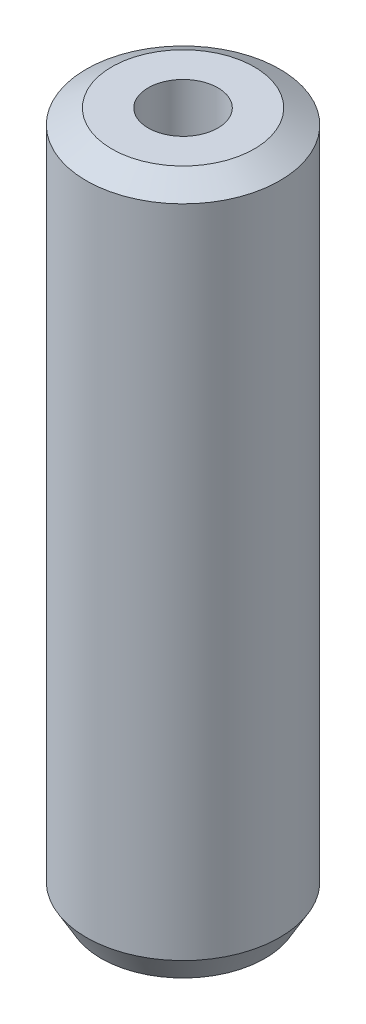
from build123d import *
from OCP.BRepFilletAPI import BRepFilletAPI_MakeChamfer

# Parameters (mm, degrees)
SKETCH1_R           = 35
BOSS_EXTRUDE1_DEPTH = 251.696371733
SKETCH2_R           = 12.617273139
CUT_EXTRUDE1_DEPTH  = 257.517179822
CHAMFER1_SIZE       = 5.330984594
CHAMFER1_SIZE2      = 9.233536171


with BuildPart() as part:
    # Sketch1 → Boss-Extrude1 (new body)
    with BuildSketch(Plane(origin=(0, 0, 0), x_dir=(1, 0, 0), z_dir=(0, 1, 0))):
        Circle(SKETCH1_R)
    extrude(amount=BOSS_EXTRUDE1_DEPTH)

    # Sketch2 → Cut-Extrude1 (cut, through all)
    with BuildSketch(Plane(origin=(0, 0, 0), x_dir=(1, 0, 0), z_dir=(0, 1, 0))):
        Circle(SKETCH2_R)
    extrude(amount=CUT_EXTRUDE1_DEPTH, mode=Mode.SUBTRACT)

    # Chamfer1: one chamfer whose edges measure the first distance from different faces: ONE call of the kernel's chamfer builder (chamfer() names one face for all edges)
    chamfer1_edges_1 = [part.edges().sort_by_distance(p)[0] for p in [
        (-35, 251.696371733, 0),
    ]]
    chamfer1_side_1 = [part.faces().sort_by_distance(p)[0] for p in [
        (-35, 125.848185867, 0),
    ]]
    chamfer1_edges_2 = [part.edges().sort_by_distance(p)[0] for p in [
        (-35, 0, 0),
    ]]
    chamfer1_side_2 = [part.faces().sort_by_distance(p)[0] for p in [
        (-34.010050506, 0, 0),
    ]]
    chamfer1 = BRepFilletAPI_MakeChamfer(part.part.solid().wrapped)
    for e in chamfer1_edges_1:
        chamfer1.Add(CHAMFER1_SIZE, CHAMFER1_SIZE2, e.wrapped, chamfer1_side_1[0].wrapped)  # the first distance lies on this face
    for e in chamfer1_edges_2:
        chamfer1.Add(CHAMFER1_SIZE, CHAMFER1_SIZE2, e.wrapped, chamfer1_side_2[0].wrapped)  # the first distance lies on this face
    add(Compound.cast(chamfer1.Shape()), mode=Mode.REPLACE)


solid = part.part
